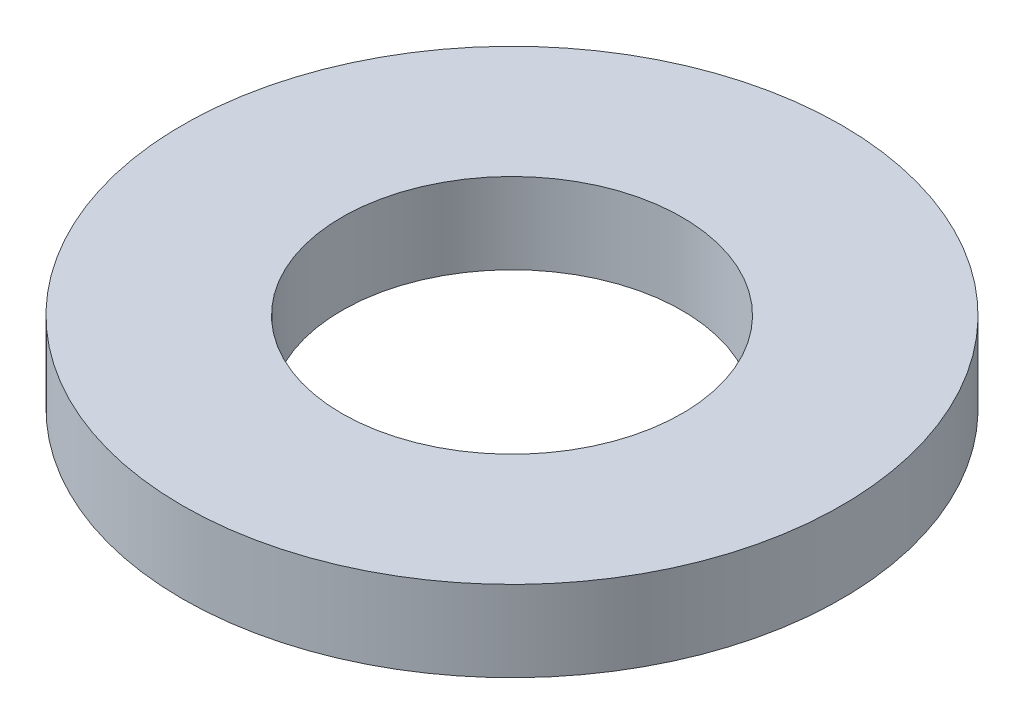
from build123d import *

# Parameters (mm, degrees)
SKETCH1_R           = 77.5
BOSS_EXTRUDE1_DEPTH = 19
SKETCH2_R           = 40
CUT_EXTRUDE1_DEPTH  = 112.236235103


with BuildPart() as part:
    # Sketch1 → Boss-Extrude1 (new body)
    with BuildSketch(Plane(origin=(0, 0, 0), x_dir=(1, 0, 0), z_dir=(0, 1, 0))):
        Circle(SKETCH1_R)
    extrude(amount=BOSS_EXTRUDE1_DEPTH)

    # Sketch2 → Cut-Extrude1 (cut, through all)
    with BuildSketch(Plane(origin=(0, 0, 0), x_dir=(1, 0, 0), z_dir=(0, 1, 0))):
        Circle(SKETCH2_R)
    extrude(amount=CUT_EXTRUDE1_DEPTH, mode=Mode.SUBTRACT)


solid = part.part
